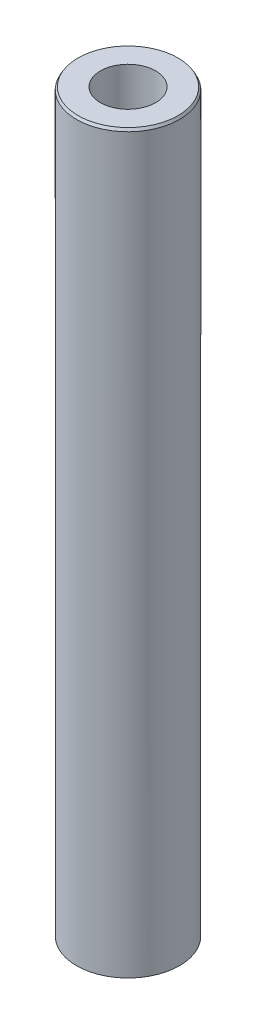
from build123d import *
from OCP.BRepFilletAPI import BRepFilletAPI_MakeChamfer

# Parameters (mm, degrees)
SKETCH1_R           = 37.5
BOSS_EXTRUDE1_DEPTH = 536.810664929
SKETCH2_R           = 20.104219109
CUT_EXTRUDE1_DEPTH  = 540.423942721
CHAMFER1_SIZE       = 1.890797424
CHAMFER1_SIZE2      = 1.091652401


with BuildPart() as part:
    # Sketch1 → Boss-Extrude1 (new body)
    with BuildSketch(Plane(origin=(0, 0, 0), x_dir=(1, 0, 0), z_dir=(0, 1, 0))):
        Circle(SKETCH1_R)
    extrude(amount=BOSS_EXTRUDE1_DEPTH)

    # Sketch2 → Cut-Extrude1 (cut, through all)
    with BuildSketch(Plane(origin=(0, 0, 0), x_dir=(1, 0, 0), z_dir=(0, 1, 0))):
        Circle(SKETCH2_R)
    extrude(amount=CUT_EXTRUDE1_DEPTH, mode=Mode.SUBTRACT)

    # Chamfer1: one chamfer whose edges measure the first distance from different faces: ONE call of the kernel's chamfer builder (chamfer() names one face for all edges)
    chamfer1_edges_1 = [part.edges().sort_by_distance(p)[0] for p in [
        (-37.5, 536.810664929, 0),
    ]]
    chamfer1_side_1 = [part.faces().sort_by_distance(p)[0] for p in [
        (-37.5, 268.405332464, 0),
    ]]
    chamfer1_edges_2 = [part.edges().sort_by_distance(p)[0] for p in [
        (-37.5, 0, 0),
    ]]
    chamfer1_side_2 = [part.faces().sort_by_distance(p)[0] for p in [
        (-36.439339828, 0, 0),
    ]]
    chamfer1 = BRepFilletAPI_MakeChamfer(part.part.solid().wrapped)
    for e in chamfer1_edges_1:
        chamfer1.Add(CHAMFER1_SIZE, CHAMFER1_SIZE2, e.wrapped, chamfer1_side_1[0].wrapped)  # the first distance lies on this face
    for e in chamfer1_edges_2:
        chamfer1.Add(CHAMFER1_SIZE, CHAMFER1_SIZE2, e.wrapped, chamfer1_side_2[0].wrapped)  # the first distance lies on this face
    add(Compound.cast(chamfer1.Shape()), mode=Mode.REPLACE)


solid = part.part
